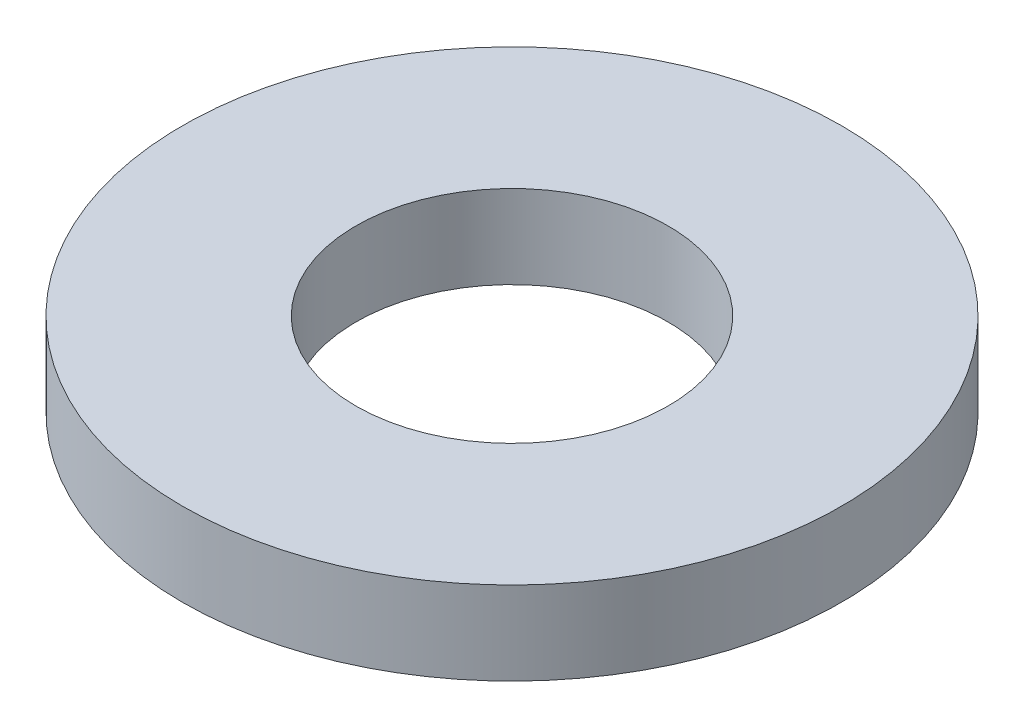
from build123d import *

# Parameters (mm, degrees)
SKETCH1_R           = 47.5
BOSS_EXTRUDE1_DEPTH = 12
SKETCH2_R           = 22.5
CUT_EXTRUDE1_DEPTH  = 69.238552153


with BuildPart() as part:
    # Sketch1 → Boss-Extrude1 (new body)
    with BuildSketch(Plane(origin=(0, 0, 0), x_dir=(1, 0, 0), z_dir=(0, 1, 0))):
        Circle(SKETCH1_R)
    extrude(amount=BOSS_EXTRUDE1_DEPTH)

    # Sketch2 → Cut-Extrude1 (cut, through all)
    with BuildSketch(Plane(origin=(0, 0, 0), x_dir=(1, 0, 0), z_dir=(0, 1, 0))):
        Circle(SKETCH2_R)
    extrude(amount=CUT_EXTRUDE1_DEPTH, mode=Mode.SUBTRACT)


solid = part.part
